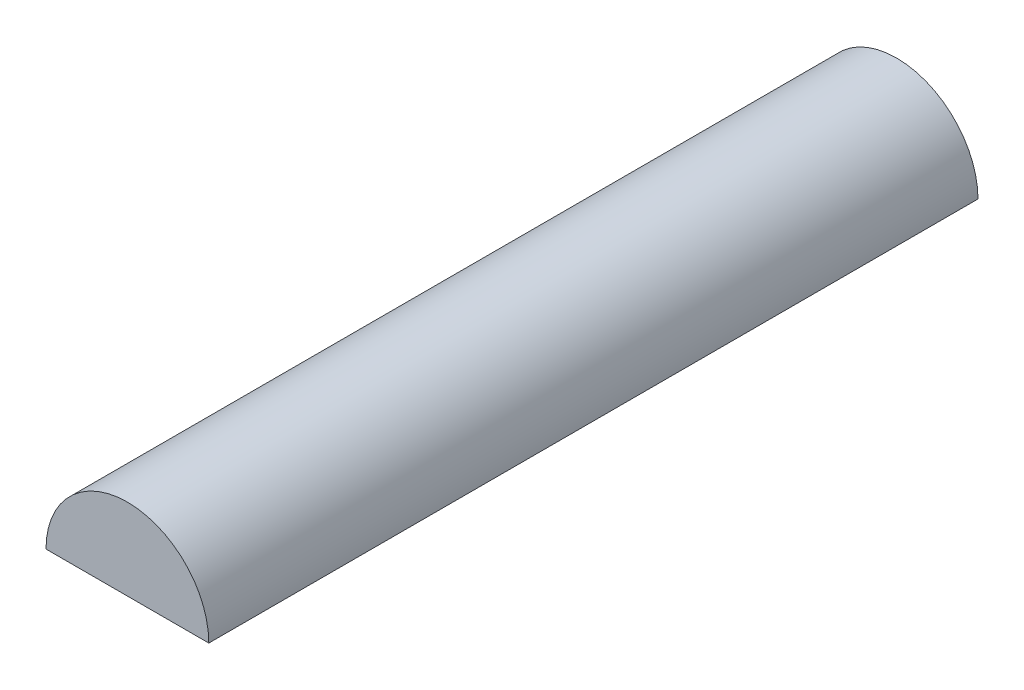
from build123d import *

# Parameters (mm, degrees)
BOSS_EXTRUDE1_DEPTH = 14.999999972


with BuildPart() as part:
    # Sketch1 → Boss-Extrude1 (new body)
    with BuildSketch(Plane.XY):
        with BuildLine():
            Line((-1.5875, 0), (1.5875, 0))
            ThreePointArc((1.5875, 0), (0, 1.5875), (-1.5875, 0))
        make_face()
    extrude(amount=BOSS_EXTRUDE1_DEPTH)


solid = part.part
